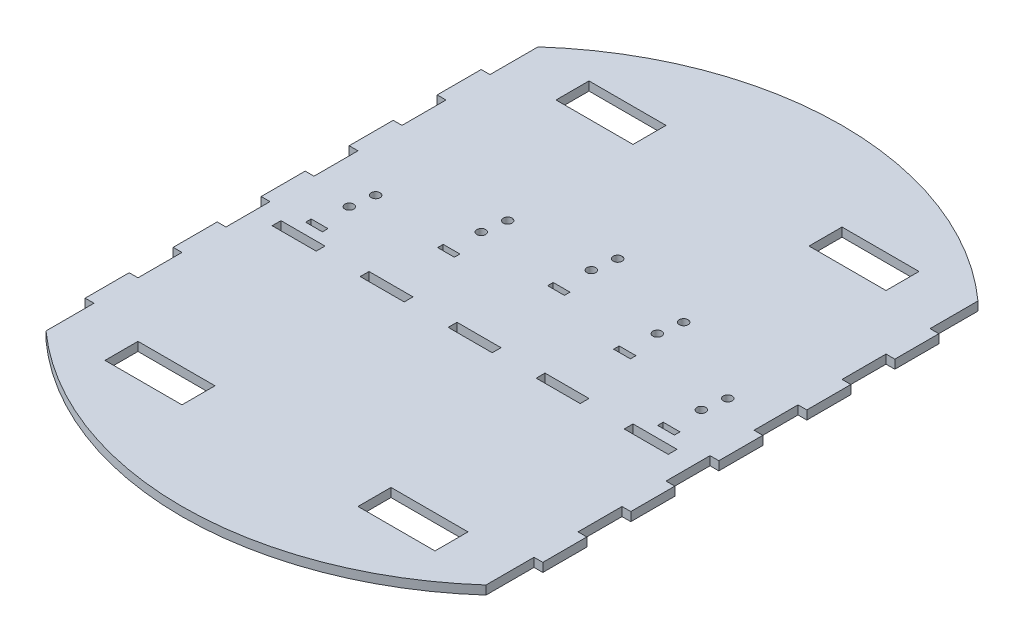
from build123d import *

# Parameters (mm, degrees)
SKICA1_R                = 2
SKICA1_W                = 7.62
SKICA1_H                = 2.54
SKICA1_W_2              = 35
SKICA1_H_2              = 15
SKICA1_W_3              = 20
SKICA1_H_3              = 4
P_IDAT_VYSUNUT_M1_DEPTH = 4


with BuildPart() as part:
    # Skica1 → Přidat vysunutím1 (new body)
    with BuildSketch(Plane(origin=(0, 0, 0), x_dir=(1, 0, 0), z_dir=(0, 1, 0))):
        with BuildLine():
            Line((-104, 10), (-104, -10))
            Line((-104, -10), (-100, -10))
            Line((-100, -10), (-100, -30))
            Line((-100, -30), (-104, -30))
            Line((-104, -30), (-104, -50))
            Line((-104, -50), (-100, -50))
            Line((-100, -50), (-100, -70))
            Line((-100, -70), (-104, -70))
            Line((-104, -70), (-104, -90))
            Line((-104, -90), (-100, -90))
            Line((-100, -90), (-100, -111.803398875))
            ThreePointArc((-100, -111.803398875), (0, -150), (100, -111.803398875))
            Line((100, -111.803398875), (100, -90))
            Line((100, -90), (104, -90))
            Line((104, -90), (104, -70))
            Line((104, -70), (100, -70))
            Line((100, -70), (100, -50))
            Line((100, -50), (104, -50))
            Line((104, -50), (104, -30))
            Line((104, -30), (100, -30))
            Line((100, -30), (100, -10))
            Line((100, -10), (104, -10))
            Line((104, -10), (104, 10))
            Line((104, 10), (100, 10))
            Line((100, 10), (100, 30))
            Line((100, 30), (104, 30))
            Line((104, 30), (104, 50))
            Line((104, 50), (100, 50))
            Line((100, 50), (100, 70))
            Line((100, 70), (104, 70))
            Line((104, 70), (104, 90))
            Line((104, 90), (100, 90))
            Line((100, 90), (100, 111.803398875))
            ThreePointArc((100, 111.803398875), (0, 150), (-100, 111.803398875))
            Line((-100, 111.803398875), (-100, 90))
            Line((-100, 90), (-104, 90))
            Line((-104, 90), (-104, 70))
            Line((-104, 70), (-100, 70))
            Line((-100, 70), (-100, 50))
            Line((-100, 50), (-104, 50))
            Line((-104, 50), (-104, 30))
            Line((-104, 30), (-100, 30))
            Line((-100, 30), (-100, 10))
            Line((-100, 10), (-104, 10))
        make_face()
        with Locations((1.5, 46.54)):
            Circle(SKICA1_R, mode=Mode.SUBTRACT)
        with Locations((0, 36.04)):
            Circle(SKICA1_R, mode=Mode.SUBTRACT)
        with Locations((0, 21.27)):
            Rectangle(SKICA1_W, SKICA1_H, mode=Mode.SUBTRACT)
        with Locations((-80, 6.04)):
            Circle(SKICA1_R, mode=Mode.SUBTRACT)
        with Locations((-78.5, 16.54)):
            Circle(SKICA1_R, mode=Mode.SUBTRACT)
        Polygon((-36.19, 10), (-43.81, 10), (-43.81, 12.54), (-40, 12.54), (-36.19, 12.54), align=None, mode=Mode.SUBTRACT)
        with Locations((-40, 26.04)):
            Circle(SKICA1_R, mode=Mode.SUBTRACT)
        with Locations((-38.5, 36.54)):
            Circle(SKICA1_R, mode=Mode.SUBTRACT)
        with Locations((-57.5, 102.5)):
            Rectangle(SKICA1_W_2, SKICA1_H_2, mode=Mode.SUBTRACT)
        with Locations((57.5, 102.5)):
            Rectangle(SKICA1_W_2, SKICA1_H_2, mode=Mode.SUBTRACT)
        Polygon((43.81, 12.54), (43.81, 10), (36.19, 10), (36.19, 12.54), (40, 12.54), align=None, mode=Mode.SUBTRACT)
        with Locations((40, 26.04)):
            Circle(SKICA1_R, mode=Mode.SUBTRACT)
        with Locations((41.5, 36.54)):
            Circle(SKICA1_R, mode=Mode.SUBTRACT)
        with Locations((80, 6.04)):
            Circle(SKICA1_R, mode=Mode.SUBTRACT)
        with Locations((81.5, 16.54)):
            Circle(SKICA1_R, mode=Mode.SUBTRACT)
        Polygon((-80, -7.46), (-76.19, -7.46), (-76.19, -10), (-83.81, -10), (-83.81, -7.46), align=None, mode=Mode.SUBTRACT)
        with Locations((0, -17)):
            Rectangle(SKICA1_W_3, SKICA1_H_3, mode=Mode.SUBTRACT)
        with Locations((-40, -17)):
            Rectangle(SKICA1_W_3, SKICA1_H_3, mode=Mode.SUBTRACT)
        with Locations((-80, -17)):
            Rectangle(SKICA1_W_3, SKICA1_H_3, mode=Mode.SUBTRACT)
        Polygon((80, -7.46), (83.81, -7.46), (83.81, -10), (76.19, -10), (76.19, -7.46), align=None, mode=Mode.SUBTRACT)
        with Locations((80, -17)):
            Rectangle(SKICA1_W_3, SKICA1_H_3, mode=Mode.SUBTRACT)
        with Locations((40, -17)):
            Rectangle(SKICA1_W_3, SKICA1_H_3, mode=Mode.SUBTRACT)
        with Locations((-57.5, -102.5)):
            Rectangle(SKICA1_W_2, SKICA1_H_2, mode=Mode.SUBTRACT)
        with Locations((57.5, -102.5)):
            Rectangle(SKICA1_W_2, SKICA1_H_2, mode=Mode.SUBTRACT)
    extrude(amount=P_IDAT_VYSUNUT_M1_DEPTH)


solid = part.part
